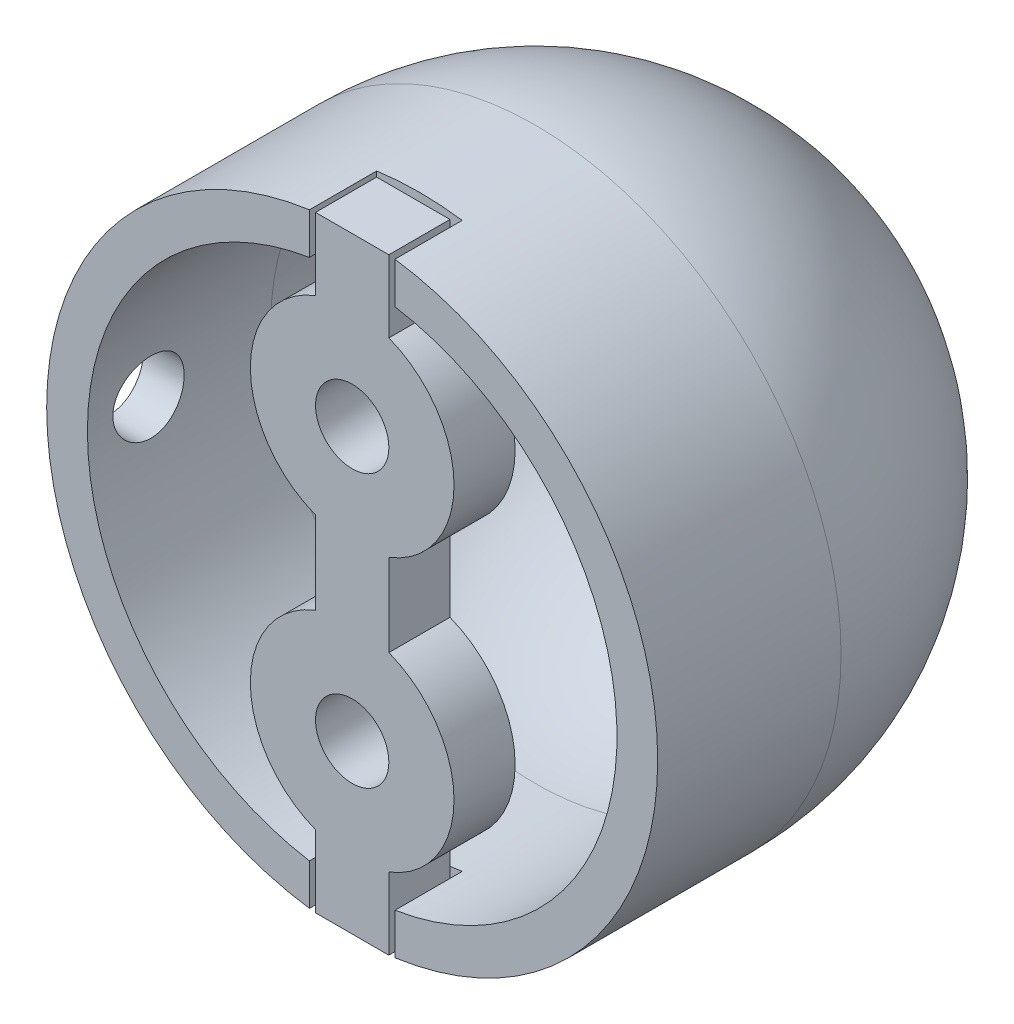
from build123d import *

# Parameters (mm, degrees)
SKETCH4_R           = 1.75
CUT_EXTRUDE1_DEPTH  = 10
SKETCH5_R           = 1.8
BOSS_EXTRUDE1_DEPTH = 3
SKETCH5_3_R         = 1.8
CUT_EXTRUDE3_DEPTH  = 20
CUT_EXTRUDE4_DEPTH  = 3.3


with BuildPart() as part:
    # Sketch2 → Revolve3 (revolve)
    with BuildSketch(Plane(origin=(0, 0, 0), x_dir=(1, 0, 0), z_dir=(0, 1, 0))):
        with BuildLine():
            ThreePointArc((15, 15), (4.393398282, 10.606601718), (0, 0))
            Line((0, 0), (0, -9))
            Line((0, -9), (2, -9))
            Line((2, -9), (2, 0))
            ThreePointArc((2, 0), (5.807611845, 9.192388155), (15, 13))
            Line((15, 13), (15, 15))
        make_face()
    revolve(axis=Axis((15, 0, -26.392000581), (0, 0, 1)))

    # Sketch4 → Cut-Extrude1 (cut)
    with BuildSketch(Plane(origin=(0, 0, 0), x_dir=(0, 0, -1), z_dir=(1, 0, 0))):
        with Locations((-6, 0)):
            Circle(SKETCH4_R)
    extrude(amount=CUT_EXTRUDE1_DEPTH, mode=Mode.SUBTRACT)

    # Sketch5<3> → Cut-Extrude3 (cut)
    with BuildSketch(Plane.XY.offset(9)):
        with Locations((15, -6.690068277)):
            Circle(SKETCH5_3_R)
        with Locations((15, 6.690068277)):
            Circle(SKETCH5_3_R)
    extrude(amount=-CUT_EXTRUDE3_DEPTH, mode=Mode.SUBTRACT)

    # Sketch5<5> → Cut-Extrude4 (cut)
    with BuildSketch(Plane.XY.offset(9)):
        with BuildLine():
            ThreePointArc((17.1, -11.227688799), (15, -11.690068277), (12.9, -11.227688799))
            Line((12.9, -11.227688799), (12.9, -15))
            Line((12.9, -15), (17.1, -15))
            Line((17.1, -15), (17.1, -11.227688799))
        make_face()
        with BuildLine():
            Line((17.1, 11.227688799), (17.1, 15))
            Line((17.1, 15), (12.9, 15))
            Line((12.9, 15), (12.9, 11.227688799))
            ThreePointArc((12.9, 11.227688799), (15, 11.690068277), (17.1, 11.227688799))
        make_face()
    extrude(amount=-CUT_EXTRUDE4_DEPTH, mode=Mode.SUBTRACT)


with BuildPart() as body_2:
    # Sketch5 → Boss-Extrude1 (new body)
    with BuildSketch(Plane.XY.offset(9)):
        with BuildLine():
            Line((13.2, -11.354829793), (13.2, -14.891608375))
            Line((13.2, -14.891608375), (16.8, -14.891608375))
            Line((16.8, -14.891608375), (16.8, -11.354829793))
            ThreePointArc((16.8, -11.354829793), (20, -6.690068277), (16.8, -2.025306761))
            Line((16.8, -2.025306761), (16.8, 2.025306761))
            ThreePointArc((16.8, 2.025306761), (20, 6.690068277), (16.8, 11.354829793))
            Line((16.8, 11.354829793), (16.8, 14.891608375))
            Line((16.8, 14.891608375), (13.2, 14.891608375))
            Line((13.2, 14.891608375), (13.2, 11.354829793))
            ThreePointArc((13.2, 11.354829793), (10, 6.690068277), (13.2, 2.025306761))
            Line((13.2, 2.025306761), (13.2, -2.025306761))
            ThreePointArc((13.2, -2.025306761), (10, -6.690068277), (13.2, -11.354829793))
        make_face()
        with Locations((15, -6.690068277)):
            Circle(SKETCH5_R, mode=Mode.SUBTRACT)
        with Locations((15, 6.690068277)):
            Circle(SKETCH5_R, mode=Mode.SUBTRACT)
    extrude(amount=-BOSS_EXTRUDE1_DEPTH)


solid = Compound([part.part, body_2.part])
